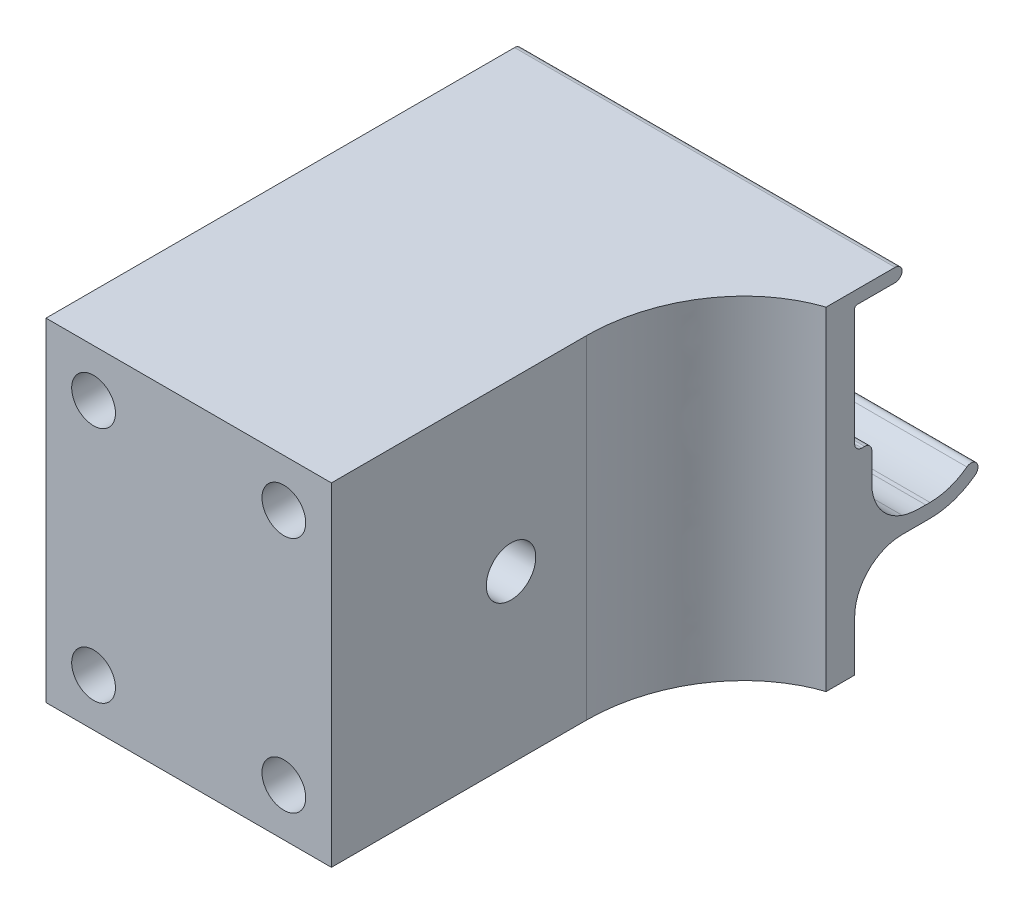
from build123d import *

# Parameters (mm, degrees)
BOSS_EXTRUDE1_DEPTH     = 35
SKETCH3_R               = 2.6
CUT_EXTRUDE1_DEPTH      = 58.716981903
FILLET1_DEPTH           = 35
SKETCH5_R               = 2.3
CUT_EXTRUDE3_DEPTH      = 10
SKETCH7_W               = 40
SKETCH7_H               = 1.4
SKETCH7_H_2             = 10
BOSS_EXTRUDE2_DEPTH     = 5
CUT_EXTRUDE2_DEPTH      = 70.641941558
CUT_EXTRUDE2_DEPTH_BACK = 12
SKETCH4_R               = 2.2
CUT_EXTRUDE4_DEPTH      = 60.843546189
FILLET2_R               = 0.75
BOSS_EXTRUDE3_DEPTH     = 40
FILLET3_R               = 0.75
FILLET4_R               = 0.25
FILLET5_R               = 5


with BuildPart() as part:
    # Sketch1 → Boss-Extrude1 (new body)
    with BuildSketch(Plane(origin=(0, 0, 0), x_dir=(1, 0, 0), z_dir=(0, 1, 0))):
        Polygon((0, 22.5), (0, -22.5), (30, -22.5), (30, 19.5), (40, 19.5), (40, 22.5), align=None)
    extrude(amount=BOSS_EXTRUDE1_DEPTH)

    # Sketch3 → Cut-Extrude1 (cut, through all)
    with BuildSketch(Plane.ZY):
        with Locations((3.62, 17.5)):
            Circle(SKETCH3_R)
    extrude(amount=-CUT_EXTRUDE1_DEPTH, mode=Mode.SUBTRACT)

    # Fillet1: read off the stored shape, not the designer's step
    # Fillet1 outline → Fillet1 (add)
    with BuildSketch(Plane(origin=(0, 0, 0), x_dir=(1, 0, 0), z_dir=(0, 1, 0))):
        with BuildLine():
            Line((30, 19.5), (30, 4.301315846))
            add(Edge.make_bspline(
                [(30, 4.301315846), (30, 16.210241525), (40, 19.5)],
                knots=[0, 0, 0, 1, 1, 1], degree=2, weights=[1, 0.810092587, 1]))
            Line((40, 19.5), (30, 19.5))
        make_face()
    extrude(amount=FILLET1_DEPTH)

    # Sketch5 → Cut-Extrude3 (cut)
    with BuildSketch(Plane.XY.offset(22.5)):
        with Locations((5, 30)):
            Circle(SKETCH5_R)
        with Locations((5, 5)):
            Circle(SKETCH5_R)
        with Locations((25, 5)):
            Circle(SKETCH5_R)
        with Locations((25, 30)):
            Circle(SKETCH5_R)
    extrude(amount=-CUT_EXTRUDE3_DEPTH, mode=Mode.SUBTRACT)

    # Sketch7 → Boss-Extrude2 (add)
    with BuildSketch(Plane(origin=(0, 0, -22.5), x_dir=(-1, 0, 0), z_dir=(0, 0, -1))):
        with Locations((-20, 34.3)):
            Rectangle(SKETCH7_W, SKETCH7_H)
        with Locations((-20, 15.30039382)):
            Rectangle(SKETCH7_W, SKETCH7_H_2)
    extrude(amount=BOSS_EXTRUDE2_DEPTH)

    # Sketch4 → Cut-Extrude2 (cut, two sides: drawn at the far end of the back side and taken through both)
    with BuildSketch(Plane(origin=(0, 0, -22.5), x_dir=(-1, 0, 0), z_dir=(0, 0, -1)).offset(-CUT_EXTRUDE2_DEPTH_BACK)):
        with Locations((-5.5, 17.5)):
            Circle(SKETCH4_R)
    extrude(amount=CUT_EXTRUDE2_DEPTH + CUT_EXTRUDE2_DEPTH_BACK, mode=Mode.SUBTRACT)

    # Sketch9 → Cut-Extrude4 (cut, through all)
    with BuildSketch(Plane(origin=(40, 0, 0), x_dir=(0, 0, -1), z_dir=(1, 0, 0))):
        with BuildLine():
            Line((27.5, 20.30039382), (24.3, 20.30039382))
            Line((24.3, 20.30039382), (24.3, 16.5))
            ThreePointArc((24.3, 16.5), (25.182933063, 13.75773816), (27.5, 12.04578851))
            Line((27.5, 12.04578851), (27.5, 20.30039382))
        make_face()
    extrude(amount=-CUT_EXTRUDE4_DEPTH, mode=Mode.SUBTRACT)

    # Fillet2
    # the kernel refuses this fillet: 0.75 mm, written as the material it takes off along each edge
    with BuildSketch(Plane(origin=(41.875, 20.30039382, -24.3), x_dir=(0, 0, 1), z_dir=(-1, 0, 0))) as fillet2_piece_1:
        with BuildLine():
            CenterArc((FILLET2_R, -FILLET2_R), FILLET2_R, 90, 90)
            Line((0, -FILLET2_R), (0, 0))
            Line((0, 0), (FILLET2_R, 0))
        make_face()
    extrude(amount=43.75, mode=Mode.SUBTRACT)

    # Sketch10 → Boss-Extrude3 (add, through all)
    with BuildSketch(Plane(origin=(40, 0, 0), x_dir=(0, 0, -1), z_dir=(1, 0, 0))):
        with BuildLine():
            Line((30.420638784, 11.76058351), (29.969418861, 11.76058351))
            add(Edge.make_bspline(
                [(27.5, 12.04578851), (28.285278796, 11.781338069), (29.10521732, 11.76058351), (29.969418861, 11.76058351)],
                knots=[0, 0, 0, 0, 1, 1, 1, 1], degree=3))
            Line((27.5, 12.04578851), (27.5, 10.30039382))
            Line((27.5, 10.30039382), (30.420638784, 10.30039382))
            ThreePointArc((30.420638784, 10.30039382), (32.925002128, 10.70728085), (35.171736316, 11.886084613))
            ThreePointArc((35.171736316, 11.886084613), (35.316984097, 12.908327269), (34.294741441, 13.05357505))
            ThreePointArc((34.294741441, 13.05357505), (32.462727085, 12.092364139), (30.420638784, 11.76058351))
        make_face()
    extrude(amount=-BOSS_EXTRUDE3_DEPTH)

    # Fillet3
    # the kernel refuses this fillet: 0.75 mm, written as the material it adds along each edge
    with BuildSketch(Plane(origin=(40, 20.30039382, -22.5), x_dir=(0, 1, 0), z_dir=(-1, 0, 0))) as fillet3_piece_1:
        with BuildLine():
            CenterArc((FILLET3_R, FILLET3_R), FILLET3_R, 180, 90)
            Line((0, FILLET3_R), (0, 0))
            Line((0, 0), (FILLET3_R, 0))
        make_face()
    extrude(amount=40)
    # the kernel refuses this fillet: 0.75 mm, written as the material it takes off along each edge
    with BuildSketch(Plane(origin=(41.875, 35, -27.5), x_dir=(0, -1, 0), z_dir=(-1, 0, 0))) as fillet3_2_piece_1:
        with BuildLine():
            CenterArc((FILLET3_R, FILLET3_R), FILLET3_R, 180, 90)
            Line((0, FILLET3_R), (0, 0))
            Line((0, 0), (FILLET3_R, 0))
        make_face()
    extrude(amount=43.75, mode=Mode.SUBTRACT)
    with BuildSketch(Plane(origin=(-1.875, 33.6, -27.5), x_dir=(0, 0, 1), z_dir=(1, 0, 0))) as fillet3_2_piece_2:
        with BuildLine():
            CenterArc((FILLET3_R, -FILLET3_R), FILLET3_R, 90, 90)
            Line((0, -FILLET3_R), (0, 0))
            Line((0, 0), (FILLET3_R, 0))
        make_face()
    extrude(amount=43.75, mode=Mode.SUBTRACT)

    # Fillet4
    fillet4_edges = [part.edges().sort_by_distance(p)[0] for p in [
        (20, 33.6, -22.5),
    ]]
    fillet(fillet4_edges, radius=FILLET4_R)

    # Fillet5
    fillet5_edges = [part.edges().sort_by_distance(p)[0] for p in [
        (20, 10.30039382, -22.5),
    ]]
    fillet(fillet5_edges, radius=FILLET5_R)


solid = part.part
